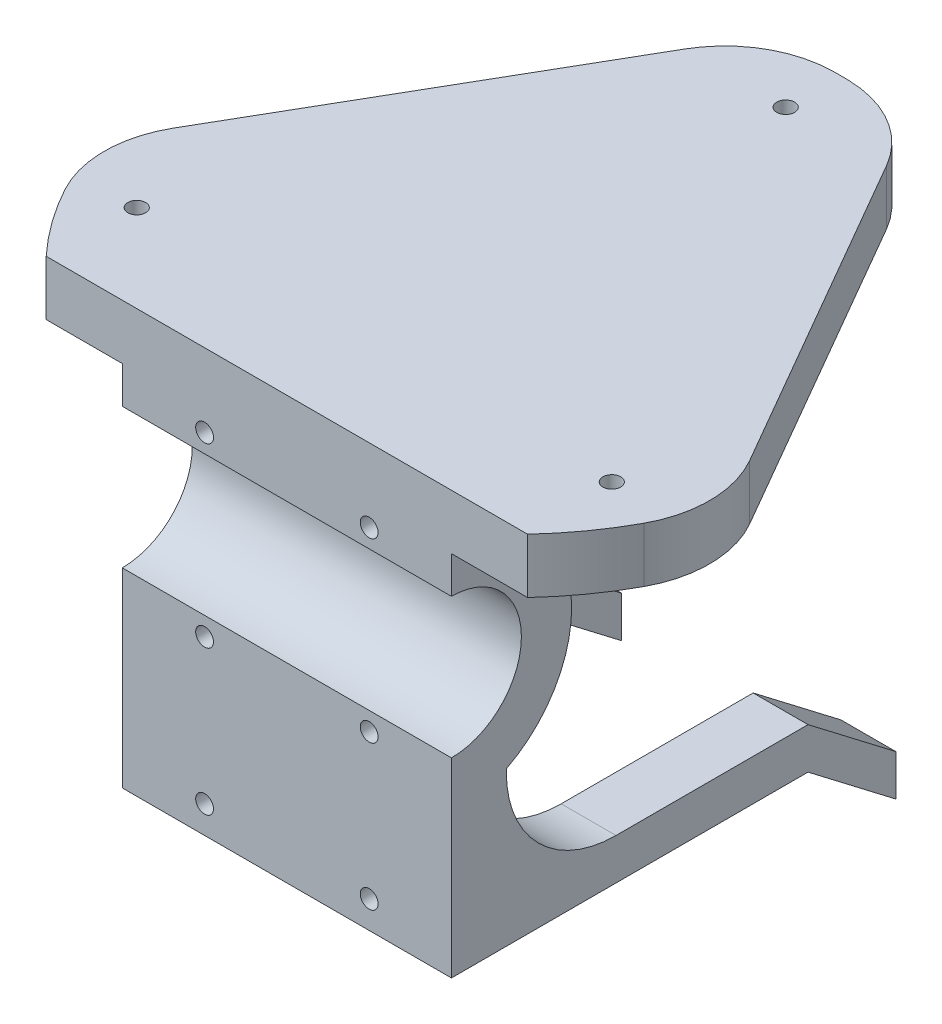
from build123d import *

# Parameters (mm, degrees)
SKETCH1_R                       = 60
BOSS_EXTRUDE1_DEPTH             = 10
SKETCH1_3_R                     = 1.625
CUT_EXTRUDE1_DEPTH              = 86.440037453
CIRPATTERN1_COUNT               = 3
CUT_EXTRUDE2_DEPTH              = 86.440037453
CIRPATTERN2_COUNT               = 3
BOSS_EXTRUDE2_DEPTH             = 77
BOSS_EXTRUDE3_REACH             = 108.685
BOSS_EXTRUDE3_DIRECTION_2_REACH = 108.685
FILLET1_R                       = 15
CUT_EXTRUDE3_DEPTH              = 107.685194831
CUT_EXTRUDE3_DEPTH_BACK         = 107.685194831
SKETCH4_4_R                     = 12.75
BOSS_EXTRUDE4_DEPTH             = 5
BOSS_EXTRUDE4_DEPTH_BACK        = 5
SKETCH7_R                       = 3
CUT_EXTRUDE4_DEPTH              = 135.046990627
SKETCH8_R                       = 3
SKETCH8_R_2                     = 1.625
BOSS_EXTRUDE5_DEPTH             = 10
LPATTERN2_COUNT                 = 2
LPATTERN2_PITCH                 = 32.26
LPATTERN3_COUNT                 = 2
LPATTERN3_PITCH                 = 58.63
FILLET2_R                       = 20
FILLET3_R                       = 20
FILLET4_R                       = 20
FILLET5_R                       = 20
SKETCH9_W                       = 55
SKETCH9_H                       = 7.5
BOSS_EXTRUDE6_DEPTH             = 10
BOSS_EXTRUDE7_DEPTH             = 10
FILLET6_R                       = 20
FILLET7_R                       = 20


with BuildPart() as part:
    # Sketch1 → Boss-Extrude1 (new body)
    with BuildSketch(Plane(origin=(0, 0, 0), x_dir=(1, 0, 0), z_dir=(0, 1, 0))):
        with Locations(Location((0, 0, 0), (0, 0, 270))):
            Circle(SKETCH1_R)
    extrude(amount=BOSS_EXTRUDE1_DEPTH)

    # Sketch1<3> → Cut-Extrude1 (cut, through all)
    with BuildSketch(Plane(origin=(0, 0, 0), x_dir=(1, 0, 0), z_dir=(0, 1, 0))):
        with Locations(Location((0, 50, 0), (0, 0, 270))):
            Circle(SKETCH1_3_R)
    cut_extrude1 = extrude(amount=CUT_EXTRUDE1_DEPTH, mode=Mode.SUBTRACT)

    # CirPattern1: Cut-Extrude1 ×3 about axis
    cirpattern1_axis = Axis((0, 0, 0), (0, 1, 0))
    for i in range(1, CIRPATTERN1_COUNT):
        add(cut_extrude1.rotate(cirpattern1_axis, i * 360 / CIRPATTERN1_COUNT), mode=Mode.SUBTRACT)

    # Sketch2 → Cut-Extrude2 (cut, through all)
    with BuildSketch(Plane(origin=(0, 10, 0), x_dir=(1, 0, 0), z_dir=(0, 1, 0))):
        with BuildLine():
            Line((43.871803017, -40.93), (0, -40.93))
            Line((0, -40.93), (-43.871803017, -40.93))
            ThreePointArc((-43.871803017, -40.93), (0, -60), (43.871803017, -40.93))
        make_face()
    cut_extrude2 = extrude(amount=-CUT_EXTRUDE2_DEPTH, mode=Mode.SUBTRACT)

    # CirPattern2: Cut-Extrude2 ×3 about axis
    cirpattern2_axis = Axis((0, 10.5, 0), (0, -1, 0))
    for i in range(1, CIRPATTERN2_COUNT):
        add(cut_extrude2.rotate(cirpattern2_axis, i * 360 / CIRPATTERN2_COUNT), mode=Mode.SUBTRACT)

    # Sketch3 → Boss-Extrude2 (add)
    with BuildSketch(Plane(origin=(0, 10, 0), x_dir=(1, 0, 0), z_dir=(0, 1, 0))):
        Polygon((-30, -40.93), (0, -40.93), (30, -40.93), (30, -30.93), (-30, -30.93), align=None)
    extrude(amount=-BOSS_EXTRUDE2_DEPTH)

    # Boss-Extrude3: up to this face of the body (flat: up to its plane)
    boss_extrude3_end = Plane(part.part.faces().sort_by_distance((30, -33.5, 35.93))[0])
    # Sketch4 → Boss-Extrude3 (add, up to the picked face)
    with BuildSketch(Plane(origin=(0, 0, 0), x_dir=(0, 0, -1), z_dir=(1, 0, 0)), mode=Mode.PRIVATE) as boss_extrude3_sk1:
        with BuildLine():
            ThreePointArc((-19.02, -19.5), (-22.236059714, -8.072633873), (-30.940100101, 0))
            Line((-30.940100101, 0), (-40.93, 0))
            Line((-40.93, 0), (-40.93, -6.75))
            ThreePointArc((-40.93, -6.75), (-31.91438854, -10.48438854), (-28.18, -19.5))
            ThreePointArc((-28.18, -19.5), (-31.91438854, -28.51561146), (-40.93, -32.25))
            Line((-40.93, -32.25), (-40.93, -41.41))
            ThreePointArc((-40.93, -41.41), (-25.437290424, -34.992709576), (-19.02, -19.5))
        make_face()
    boss_extrude3_tool1 = split(extrude(boss_extrude3_sk1.sketch, amount=BOSS_EXTRUDE3_REACH, mode=Mode.PRIVATE), bisect_by=boss_extrude3_end, keep=Keep.BOTH, mode=Mode.PRIVATE)
    add(boss_extrude3_tool1.solids().sort_by(Axis((0, -10.153116, 31.583116), (1, 0, 0)))[0])

    # Boss-Extrude3 direction 2: up to this face of the body (flat: up to its plane)
    boss_extrude3_direction_2_end = Plane(part.part.faces().sort_by_distance((-30, -33.5, 35.93))[0])
    # Sketch4 → Boss-Extrude3 direction 2 (add, up to the picked face)
    with BuildSketch(Plane(origin=(0, 0, 0), x_dir=(0, 0, -1), z_dir=(1, 0, 0)), mode=Mode.PRIVATE) as boss_extrude3_direction_2_sk1:
        with BuildLine():
            ThreePointArc((-19.02, -19.5), (-22.236059714, -8.072633873), (-30.940100101, 0))
            Line((-30.940100101, 0), (-40.93, 0))
            Line((-40.93, 0), (-40.93, -6.75))
            ThreePointArc((-40.93, -6.75), (-31.91438854, -10.48438854), (-28.18, -19.5))
            ThreePointArc((-28.18, -19.5), (-31.91438854, -28.51561146), (-40.93, -32.25))
            Line((-40.93, -32.25), (-40.93, -41.41))
            ThreePointArc((-40.93, -41.41), (-25.437290424, -34.992709576), (-19.02, -19.5))
        make_face()
    boss_extrude3_direction_2_tool1 = split(extrude(boss_extrude3_direction_2_sk1.sketch, amount=-BOSS_EXTRUDE3_DIRECTION_2_REACH, mode=Mode.PRIVATE), bisect_by=boss_extrude3_direction_2_end, keep=Keep.BOTH, mode=Mode.PRIVATE)
    add(boss_extrude3_direction_2_tool1.solids().sort_by(Axis((0, -10.153116, 31.583116), (-1, 0, 0)))[0])

    # Fillet1
    # the kernel refuses this fillet: 15 mm, written as the material it adds along each edge
    with BuildSketch(Plane(origin=(30, 0, 30.93), x_dir=(0, -0.8200000187317444, -0.5723634940140216), z_dir=(-1, 0, 0))) as fillet1_piece_1:
        with BuildLine():
            CenterArc((27.544705674, -13.254966901), FILLET1_R, 117.912385257, 97.002819116)
            Line((15.244705393, -21.840419312), (14.014705365, -22.698964553))
            Line((14.014705365, -22.698964553), (-1.230000028, -0.858545241))
            Line((-1.230000028, -0.858545241), (-0.858545241, 1.230000028))
            ThreePointArc((-0.858545241, 1.230000028), (0.706809752, 1.32825728), (19.820711794, 1.32549669))
            Line((19.820711794, 1.32549669), (20.522893056, 0))
        make_face()
    extrude(amount=60)
    with BuildSketch(Plane(origin=(30, -0.00517761, 30.93), x_dir=(0, -0.819917344642304, -0.5724819193255918), z_dir=(-1, 0, 0))) as fillet1_piece_2:
        with BuildLine():
            CenterArc((27.542374568, -13.253952614), FILLET1_R, 117.920660394, 97.002819116)
            Line((15.243614398, -21.841181404), (14.013738381, -22.699904283))
            ThreePointArc((14.013738381, -22.699904283), (-1.23412123, -0.861686967), (-0.858722879, 1.229876017))
            Line((-0.858722879, 1.229876017), (0.702372694, 1.325395261))
            ThreePointArc((0.702372694, 1.325395261), (10.259323815, -1.050393215), (19.816274935, 1.325395261))
            Line((19.816274935, 1.325395261), (20.518647629, 0))
        make_face()
    extrude(amount=60)

    # Sketch4<4> → Cut-Extrude3 (cut, two sides: drawn at the far end of the back side and taken through both)
    with BuildSketch(Plane(origin=(0, 0, 0), x_dir=(0, 0, -1), z_dir=(1, 0, 0)).offset(-CUT_EXTRUDE3_DEPTH_BACK)):
        with Locations((-40.93, -19.5)):
            Circle(SKETCH4_4_R)
    extrude(amount=CUT_EXTRUDE3_DEPTH + CUT_EXTRUDE3_DEPTH_BACK, mode=Mode.SUBTRACT)

    # Sketch6 → Boss-Extrude4 (add, two sides: drawn at the far end of the back side and taken through both)
    with BuildSketch(Plane(origin=(0, 0, 0), x_dir=(0, 0, -1), z_dir=(1, 0, 0)).offset(-BOSS_EXTRUDE4_DEPTH_BACK)):
        Polygon((-30.93, -57), (-30.93, -67), (40.93, 0), (30.93, 0), align=None)
    extrude(amount=BOSS_EXTRUDE4_DEPTH + BOSS_EXTRUDE4_DEPTH_BACK)

    # Sketch7 → Cut-Extrude4 (cut, through all)
    with BuildSketch(Plane.XY.offset(40.93)):
        with Locations((-15, -3.375)):
            Circle(SKETCH7_R)
        with Locations((15, -3.375)):
            Circle(SKETCH7_R)
    cut_extrude4 = extrude(amount=-CUT_EXTRUDE4_DEPTH, mode=Mode.SUBTRACT)

    # Sketch8 → Boss-Extrude5 (add)
    # profile 1 of 2: a face of its own
    with BuildSketch(Plane.XY.offset(40.93)):
        with Locations((-15, -3.375)):
            Circle(SKETCH8_R)
        with Locations((-15, -3.375)):
            Circle(SKETCH8_R_2, mode=Mode.SUBTRACT)
    # profile 2 of 2: a face of its own
    with BuildSketch(Plane.XY.offset(40.93)):
        with Locations((15, -3.375)):
            Circle(SKETCH8_R)
        with Locations((15, -3.375)):
            Circle(SKETCH8_R_2, mode=Mode.SUBTRACT)
    boss_extrude5 = extrude(amount=-BOSS_EXTRUDE5_DEPTH)

    # LPattern2: Cut-Extrude4, Boss-Extrude5 ×2
    with Locations(*[(0, -i * LPATTERN2_PITCH, 0) for i in range(1, LPATTERN2_COUNT)]):
        add(cut_extrude4, mode=Mode.SUBTRACT)
        add(boss_extrude5)

    # LPattern3: Cut-Extrude4, Boss-Extrude5 ×2
    with Locations(*[(0, -i * LPATTERN3_PITCH, 0) for i in range(1, LPATTERN3_COUNT)]):
        add(cut_extrude4, mode=Mode.SUBTRACT)
        add(boss_extrude5)

    # Fillet2
    fillet2_edges = [part.edges().sort_by_distance(p)[0] for p in [
        (57.382321286, 5, 17.529095923),
    ]]
    fillet(fillet2_edges, radius=FILLET2_R)

    # Fillet3
    fillet3_edges = [part.edges().sort_by_distance(p)[0] for p in [
        (13.510518268, 5, -58.459095923),
    ]]
    fillet(fillet3_edges, radius=FILLET3_R)

    # Fillet4
    fillet4_edges = [part.edges().sort_by_distance(p)[0] for p in [
        (-13.510518268, 5, -58.459095923),
    ]]
    fillet(fillet4_edges, radius=FILLET4_R)

    # Fillet5
    fillet5_edges = [part.edges().sort_by_distance(p)[0] for p in [
        (-57.382321286, 5, 17.529095923),
    ]]
    fillet(fillet5_edges, radius=FILLET5_R)

    # Sketch9 → Boss-Extrude6 (add)
    with BuildSketch(Plane(origin=(30, 0, 0), x_dir=(0, 0, -1), z_dir=(1, 0, 0))):
        with Locations((-3.43, -63.25)):
            Rectangle(SKETCH9_W, SKETCH9_H)
    boss_extrude6 = extrude(amount=-BOSS_EXTRUDE6_DEPTH)

    # Sketch10 → Boss-Extrude7 (add)
    with BuildSketch(Plane(origin=(30, 0, 0), x_dir=(0, 0, -1), z_dir=(1, 0, 0))):
        Polygon((40.07, -79.25), (40.07, -71.75), (24.07, -59.5), (24.07, -67), align=None)
    boss_extrude7 = extrude(amount=-BOSS_EXTRUDE7_DEPTH)

    # Fillet6
    fillet6_edges = [part.edges().sort_by_distance(p)[0] for p in [
        (25, -59.5, 30.93),
    ]]
    fillet(fillet6_edges, radius=FILLET6_R)

    # Mirror1: Boss-Extrude6, Boss-Extrude7 across plane
    add(boss_extrude6.mirror(Plane(origin=(0, 0, 0), x_dir=(0, 0, 1), z_dir=(1, 0, 0))))
    add(boss_extrude7.mirror(Plane(origin=(0, 0, 0), x_dir=(0, 0, 1), z_dir=(1, 0, 0))))

    # Fillet7
    fillet7_edges = [part.edges().sort_by_distance(p)[0] for p in [
        (-25, -59.5, 30.93),
    ]]
    fillet(fillet7_edges, radius=FILLET7_R)


solid = part.part
